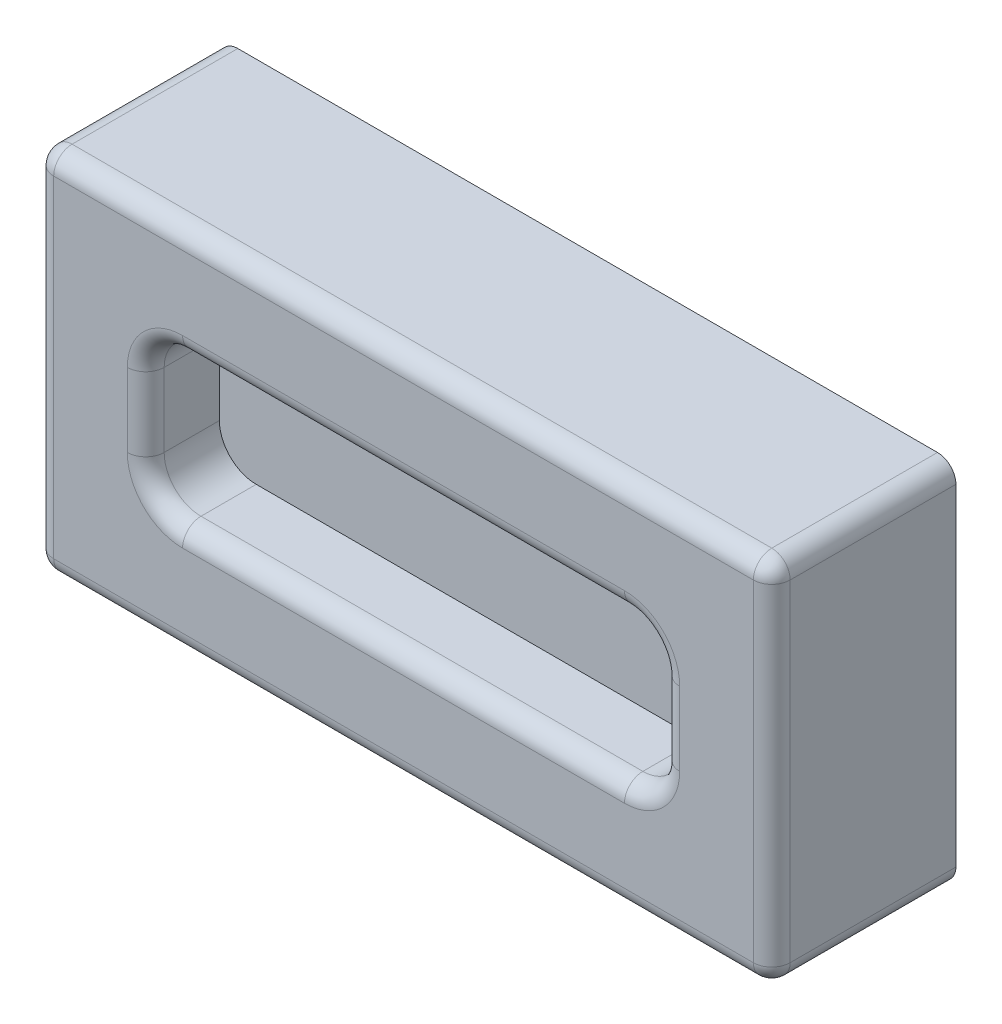
from build123d import *

# Parameters (mm, degrees)
SKIZZE1_W                       = 20
SKIZZE1_H                       = 10
AUFSATZ_LINEAR_AUSTRAGEN1_DEPTH = 5
SCHNITT_LINEAR_AUSTRAGEN2_DEPTH = 2
VERRUNDUNG2_R                   = 0.5
VERRUNDUNG3_R                   = 0.5
VERRUNDUNG4_R                   = 0.5
VERRUNDUNG5_R                   = 0.5
VERRUNDUNG6_R                   = 0.5
VERRUNDUNG7_R                   = 0.5


with BuildPart() as part:
    # Skizze1 → Aufsatz-Linear austragen1 (new body)
    with BuildSketch(Plane.XY):
        with Locations((10, 5)):
            Rectangle(SKIZZE1_W, SKIZZE1_H)
    extrude(amount=AUFSATZ_LINEAR_AUSTRAGEN1_DEPTH)

    # Skizze3 → Schnitt-Linear austragen2 (cut)
    with BuildSketch(Plane.XY.offset(5)):
        with BuildLine():
            Line((4, 7), (16, 7))
            ThreePointArc((16, 7), (16.707106781, 6.707106781), (17, 6))
            Line((17, 6), (17, 4))
            ThreePointArc((17, 4), (16.707106781, 3.292893219), (16, 3))
            Line((16, 3), (4, 3))
            ThreePointArc((4, 3), (3.292893219, 3.292893219), (3, 4))
            Line((3, 4), (3, 6))
            ThreePointArc((3, 6), (3.292893219, 6.707106781), (4, 7))
        make_face()
    extrude(amount=-SCHNITT_LINEAR_AUSTRAGEN2_DEPTH, mode=Mode.SUBTRACT)

    # Verrundung2
    verrundung2_edges = [part.edges().sort_by_distance(p)[0] for p in [
        (3.292893219, 3.292893219, 5),
        (10, 3, 5),
        (16.707106781, 3.292893219, 5),
        (17, 5, 5),
        (16.707106781, 6.707106781, 5),
        (10, 7, 5),
        (3.292893219, 6.707106781, 5),
        (3, 5, 5),
    ]]
    fillet(verrundung2_edges, radius=VERRUNDUNG2_R)

    # Verrundung3
    verrundung3_edges = [part.edges().sort_by_distance(p)[0] for p in [
        (20, 5, 5),
        (10, 10, 5),
        (0, 5, 5),
        (10, 0, 5),
    ]]
    fillet(verrundung3_edges, radius=VERRUNDUNG3_R)

    # Verrundung4
    # the kernel refuses this fillet: 0.5 mm, written as the material it takes off along each edge
    with BuildSketch(Plane(origin=(19.5, 9.5, 4.5), x_dir=(0, 1, 0), z_dir=(1, 0, 0))) as verrundung4_piece_1_section:
        Polygon((0, 0), (VERRUNDUNG4_R, 0), (VERRUNDUNG4_R, VERRUNDUNG4_R), (0, VERRUNDUNG4_R), align=None)
    verrundung4_piece_1 = extrude(amount=VERRUNDUNG4_R, mode=Mode.PRIVATE)
    verrundung4_piece_1 = verrundung4_piece_1 - Plane(origin=(19.5, 9.5, 4.5), x_dir=(0, -0.7071067811865475, -0.7071067811865475), z_dir=(1, 0, 0)) * Sphere(VERRUNDUNG4_R, mode=Mode.PRIVATE)
    add(verrundung4_piece_1, mode=Mode.SUBTRACT)
    with BuildSketch(Plane(origin=(20, 10, -1.25), x_dir=(0, -1, 0), z_dir=(0, 0, 1))) as verrundung4_piece_2:
        with BuildLine():
            CenterArc((VERRUNDUNG4_R, -VERRUNDUNG4_R), VERRUNDUNG4_R, 90, 90)
            Line((0, -VERRUNDUNG4_R), (0, 0))
            Line((0, 0), (VERRUNDUNG4_R, 0))
        make_face()
    extrude(amount=5.75, mode=Mode.SUBTRACT)

    # Verrundung5
    # the kernel refuses this fillet: 0.5 mm, written as the material it takes off along each edge
    with BuildSketch(Plane(origin=(0.5, 9.5, 4.5), x_dir=(-1, 0, 0), z_dir=(0, 1, 0))) as verrundung5_piece_1_section:
        Polygon((0, 0), (VERRUNDUNG5_R, 0), (VERRUNDUNG5_R, VERRUNDUNG5_R), (0, VERRUNDUNG5_R), align=None)
    verrundung5_piece_1 = extrude(amount=VERRUNDUNG5_R, mode=Mode.PRIVATE)
    verrundung5_piece_1 = verrundung5_piece_1 - Plane(origin=(0.5, 9.5, 4.5), x_dir=(0.7071067811865475, 0, -0.7071067811865475), z_dir=(0, 1, 0)) * Sphere(VERRUNDUNG5_R, mode=Mode.PRIVATE)
    add(verrundung5_piece_1, mode=Mode.SUBTRACT)
    with BuildSketch(Plane(origin=(0, 10, -1.25), x_dir=(1, 0, 0), z_dir=(0, 0, 1))) as verrundung5_piece_2:
        with BuildLine():
            CenterArc((VERRUNDUNG5_R, -VERRUNDUNG5_R), VERRUNDUNG5_R, 90, 90)
            Line((0, -VERRUNDUNG5_R), (0, 0))
            Line((0, 0), (VERRUNDUNG5_R, 0))
        make_face()
    extrude(amount=5.75, mode=Mode.SUBTRACT)

    # Verrundung6
    # the kernel refuses this fillet: 0.5 mm, written as the material it takes off along each edge
    with BuildSketch(Plane(origin=(0.5, 0.5, 4.5), x_dir=(-1, 0, 0), z_dir=(0, -1, 0))) as verrundung6_piece_1_section:
        Polygon((0, 0), (VERRUNDUNG6_R, 0), (VERRUNDUNG6_R, -VERRUNDUNG6_R), (0, -VERRUNDUNG6_R), align=None)
    verrundung6_piece_1 = extrude(amount=VERRUNDUNG6_R, mode=Mode.PRIVATE)
    verrundung6_piece_1 = verrundung6_piece_1 - Plane(origin=(0.5, 0.5, 4.5), x_dir=(0.7071067811865475, 0, -0.7071067811865475), z_dir=(0, -1, 0)) * Sphere(VERRUNDUNG6_R, mode=Mode.PRIVATE)
    add(verrundung6_piece_1, mode=Mode.SUBTRACT)
    with BuildSketch(Plane(origin=(0, 0, -1.25), x_dir=(1, 0, 0), z_dir=(0, 0, 1))) as verrundung6_piece_2:
        with BuildLine():
            CenterArc((VERRUNDUNG6_R, VERRUNDUNG6_R), VERRUNDUNG6_R, 180, 90)
            Line((0, VERRUNDUNG6_R), (0, 0))
            Line((0, 0), (VERRUNDUNG6_R, 0))
        make_face()
    extrude(amount=5.75, mode=Mode.SUBTRACT)

    # Verrundung7
    # the kernel refuses this fillet: 0.5 mm, written as the material it takes off along each edge
    with BuildSketch(Plane(origin=(19.5, 0.5, 4.5), x_dir=(0, -1, 0), z_dir=(1, 0, 0))) as verrundung7_piece_1_section:
        Polygon((0, 0), (VERRUNDUNG7_R, 0), (VERRUNDUNG7_R, -VERRUNDUNG7_R), (0, -VERRUNDUNG7_R), align=None)
    verrundung7_piece_1 = extrude(amount=VERRUNDUNG7_R, mode=Mode.PRIVATE)
    verrundung7_piece_1 = verrundung7_piece_1 - Plane(origin=(19.5, 0.5, 4.5), x_dir=(0, 0.7071067811865475, -0.7071067811865475), z_dir=(1, 0, 0)) * Sphere(VERRUNDUNG7_R, mode=Mode.PRIVATE)
    add(verrundung7_piece_1, mode=Mode.SUBTRACT)
    with BuildSketch(Plane(origin=(20, 0, -1.25), x_dir=(0, 1, 0), z_dir=(0, 0, 1))) as verrundung7_piece_2:
        with BuildLine():
            CenterArc((VERRUNDUNG7_R, VERRUNDUNG7_R), VERRUNDUNG7_R, 180, 90)
            Line((0, VERRUNDUNG7_R), (0, 0))
            Line((0, 0), (VERRUNDUNG7_R, 0))
        make_face()
    extrude(amount=5.75, mode=Mode.SUBTRACT)


solid = part.part
